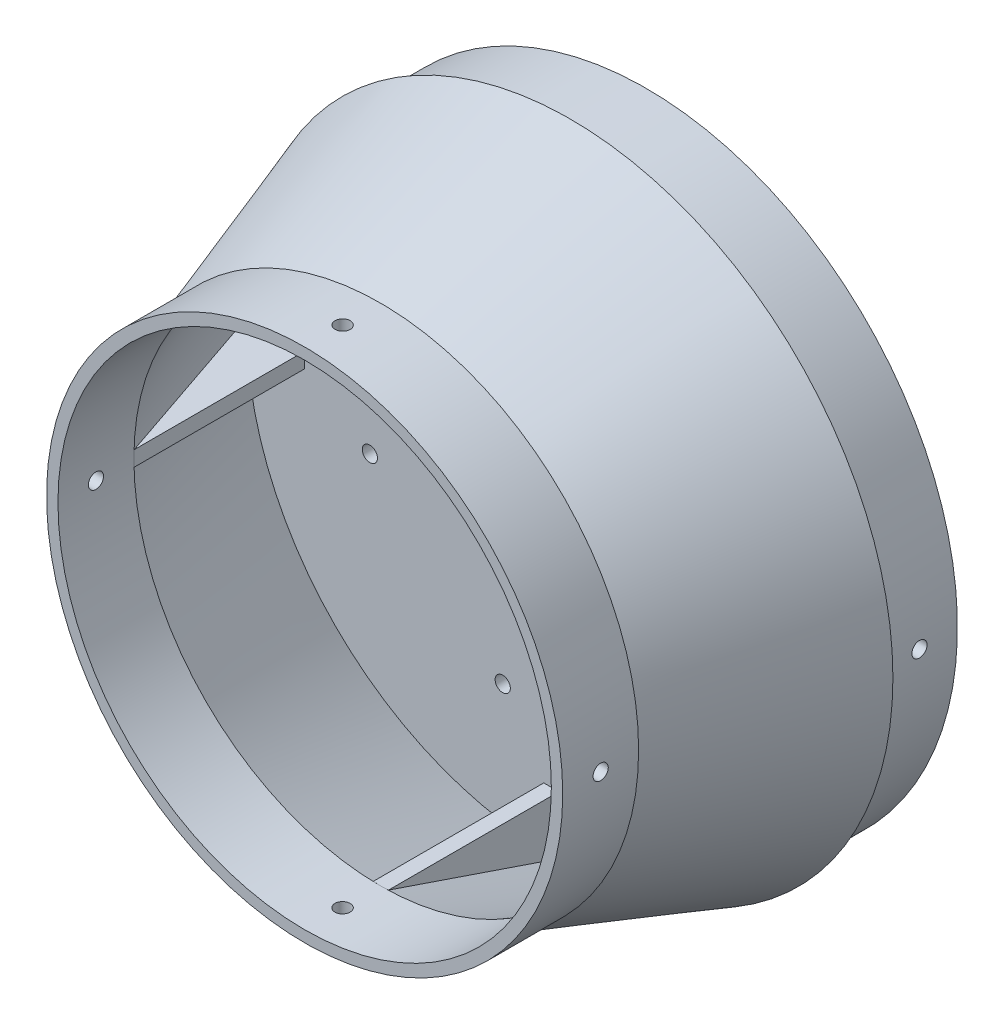
from build123d import *

# Parameters (mm, degrees)
BOSS_EXTRUDE5_DEPTH             = 2
CIRPATTERN3_COUNT               = 4
BOSS_EXTRUDE6_DEPTH             = 20
SKETCH14_R                      = 2
CUT_EXTRUDE1_DEPTH              = 95
CIRPATTERN4_COUNT               = 4
FILLET1_R                       = 5
SKETCH16_R                      = 2
CUT_EXTRUDE2_DEPTH              = 94
CIRPATTERN5_COUNT               = 2
CIRPATTERN5_ANGLE               = 90
CIRPATTERN5_THE_OTHER_WAY_COUNT = 2
CIRPATTERN5_THE_OTHER_WAY_ANGLE = 90
SKETCH17_R                      = 2
CUT_EXTRUDE4_DEPTH              = 900


with BuildPart() as part:
    # Sketch10 → Revolve2 (revolve)
    with BuildSketch(Plane(origin=(0, 0, 0), x_dir=(1, 0, 0), z_dir=(0, 1, 0))):
        Polygon((68, 0), (85, 50), (0, 50), (0, 45), (80.3, 45), (65, 0), (65, -20), (68, -20), align=None)
    revolve(axis=Axis((0, 0, 0), (0, 0, -1)))

    # Sketch12 → Boss-Extrude5 (add, symmetric)
    with BuildSketch(Plane(origin=(0, 0, 0), x_dir=(1, 0, 0), z_dir=(0, 1, 0))):
        Polygon((-80.3, 45), (-65, 0), (-65, 45), align=None)
    boss_extrude5 = extrude(amount=BOSS_EXTRUDE5_DEPTH, both=True)

    # CirPattern3: Boss-Extrude5 ×4 about axis
    cirpattern3_axis = Axis((0, 0, -50), (0, 0, 1))
    for i in range(1, CIRPATTERN3_COUNT):
        add(boss_extrude5.rotate(cirpattern3_axis, i * 360 / CIRPATTERN3_COUNT))

    # Sketch13 → Boss-Extrude6 (add)
    with BuildSketch(Plane(origin=(0, 0, -50), x_dir=(-1, 0, 0), z_dir=(0, 0, -1))):
        with BuildLine():
            ThreePointArc((82, 0), (78.943017424, 22.181073013), (70, 42.708313008))
            ThreePointArc((70, 42.708313008), (-82, 0), (70, -42.708313008))
            ThreePointArc((70, -42.708313008), (78.943017424, -22.181073013), (82, 0))
        make_face()
        with BuildLine():
            ThreePointArc((70, -34.409301068), (-78, 0), (70, 34.409301068))
            ThreePointArc((70, 34.409301068), (75.973679653, 17.663521733), (78, 0))
            ThreePointArc((78, 0), (75.973679653, -17.663521733), (70, -34.409301068))
        make_face(mode=Mode.SUBTRACT)
    extrude(amount=BOSS_EXTRUDE6_DEPTH)

    # Sketch14 → Cut-Extrude1 (cut)
    with BuildSketch(Plane(origin=(0, 0, 0), x_dir=(1, 0, 0), z_dir=(0, 1, 0))):
        with Locations((0, -10)):
            Circle(SKETCH14_R)
    cut_extrude1 = extrude(amount=-CUT_EXTRUDE1_DEPTH, mode=Mode.SUBTRACT)

    # CirPattern4: Cut-Extrude1 ×4 about axis
    cirpattern4_axis = Axis((0, 0, 20), (0, 0, 1))
    for i in range(1, CIRPATTERN4_COUNT):
        add(cut_extrude1.rotate(cirpattern4_axis, i * 360 / CIRPATTERN4_COUNT), mode=Mode.SUBTRACT)

    # Fillet1
    fillet1_edges = [part.edges().sort_by_distance(p)[0] for p in [
        (70, -34.409301068, -50),
    ]]
    fillet(fillet1_edges, radius=FILLET1_R)

    # Sketch16 → Cut-Extrude2 (cut)
    with BuildSketch(Plane(origin=(0, 0, 0), x_dir=(1, 0, 0), z_dir=(0, 1, 0))):
        with Locations((0, 60)):
            Circle(SKETCH16_R)
    cut_extrude2 = extrude(amount=-CUT_EXTRUDE2_DEPTH, mode=Mode.SUBTRACT)

    # CirPattern5: Cut-Extrude2 ×2 about axis
    cirpattern5_axis = Axis((0, 0, -70), (0, 0, -1))
    for i in range(1, CIRPATTERN5_COUNT):
        add(cut_extrude2.rotate(cirpattern5_axis, i * CIRPATTERN5_ANGLE / (CIRPATTERN5_COUNT - 1)), mode=Mode.SUBTRACT)

    # CirPattern5 the other way: Cut-Extrude2 ×2 about axis
    cirpattern5_the_other_way_axis = Axis((0, 0, -70), (0, 0, 1))
    for i in range(1, CIRPATTERN5_THE_OTHER_WAY_COUNT):
        add(cut_extrude2.rotate(cirpattern5_the_other_way_axis, i * CIRPATTERN5_THE_OTHER_WAY_ANGLE / (CIRPATTERN5_THE_OTHER_WAY_COUNT - 1)), mode=Mode.SUBTRACT)

    # Sketch17 → Cut-Extrude4 (cut)
    with BuildSketch(Plane(origin=(0, 0, -50), x_dir=(-1, 0, 0), z_dir=(0, 0, -1))):
        with Locations((-47.813328401, 12.811542733)):
            Circle(SKETCH17_R)
        with Locations((-12.811542733, 47.813328401)):
            Circle(SKETCH17_R)
        with Locations((12.811542733, -47.813328401)):
            Circle(SKETCH17_R)
        with Locations((47.813328401, -12.811542733)):
            Circle(SKETCH17_R)
    extrude(amount=-CUT_EXTRUDE4_DEPTH, mode=Mode.SUBTRACT)


solid = part.part
